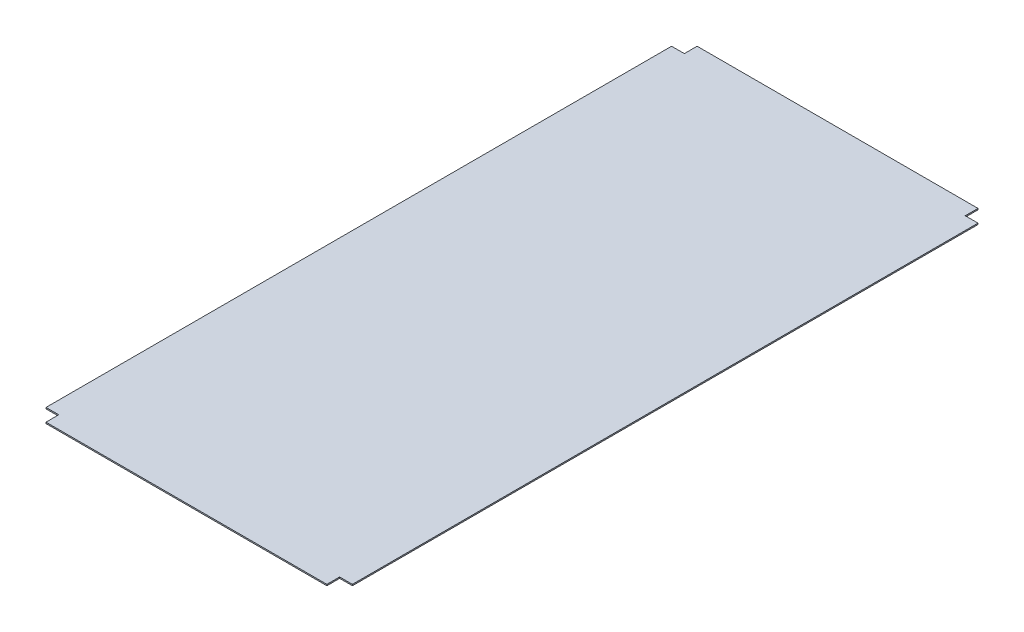
from build123d import *

# Parameters (mm, degrees)
CROQUIS1_W              = 720
CROQUIS1_H              = 1530
SALIENTE_EXTRUIR1_DEPTH = 3
CROQUIS2_W              = 30
CROQUIS2_H              = 30
CORTAR_EXTRUIR1_DEPTH   = 846.478562709


with BuildPart() as part:
    # Croquis1 → Saliente-Extruir1 (new body)
    with BuildSketch(Plane(origin=(0, 0, 0), x_dir=(1, 0, 0), z_dir=(0, 1, 0))):
        Rectangle(CROQUIS1_W, CROQUIS1_H)
    extrude(amount=SALIENTE_EXTRUIR1_DEPTH)

    # Croquis2 → Cortar-Extruir1 (cut, through all)
    with BuildSketch(Plane(origin=(0, 3, 0), x_dir=(1, 0, 0), z_dir=(0, 1, 0))):
        with Locations((-345, 750)):
            Rectangle(CROQUIS2_W, CROQUIS2_H)
        with Locations((345, 750)):
            Rectangle(CROQUIS2_W, CROQUIS2_H)
        with Locations((345, -750)):
            Rectangle(CROQUIS2_W, CROQUIS2_H)
        with Locations((-345, -750)):
            Rectangle(CROQUIS2_W, CROQUIS2_H)
    extrude(amount=-CORTAR_EXTRUIR1_DEPTH, mode=Mode.SUBTRACT)


solid = part.part
